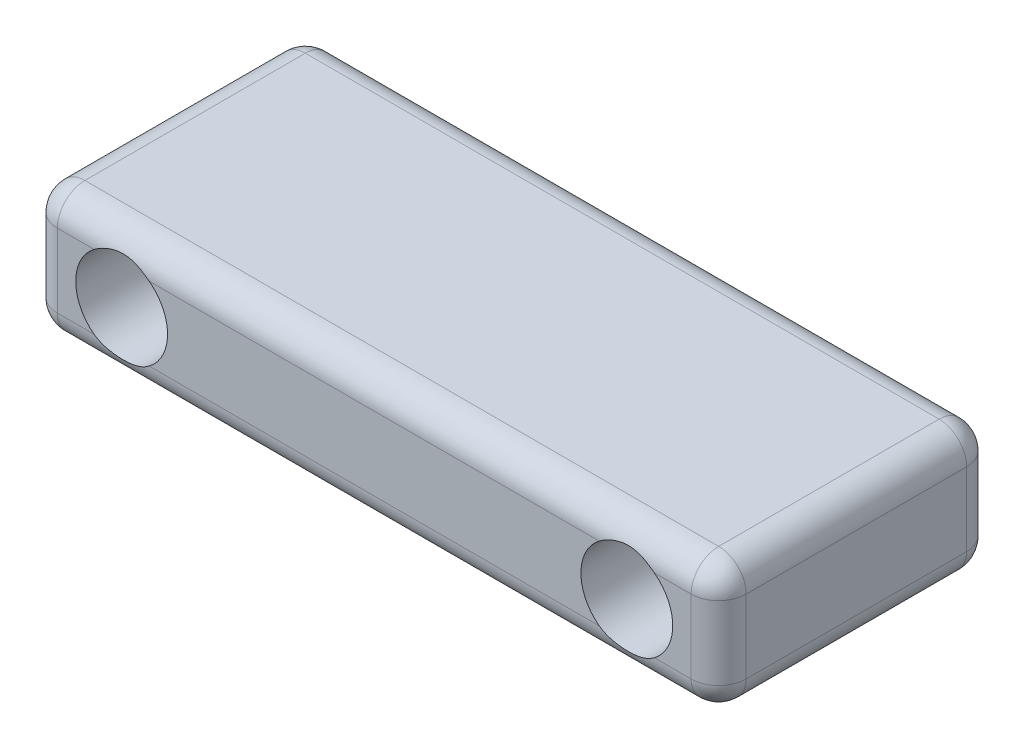
from build123d import *

# Parameters (mm, degrees)
SKETCH1_W           = 75
SKETCH1_H           = 14
SKETCH1_R           = 5
BOSS_EXTRUDE1_DEPTH = 30
FILLET1_R           = 3


with BuildPart() as part:
    # Sketch1 → Boss-Extrude1 (new body)
    with BuildSketch(Plane.XY):
        Rectangle(SKETCH1_W, SKETCH1_H)
        with Locations((27.5, 0)):
            Circle(SKETCH1_R, mode=Mode.SUBTRACT)
        with Locations((-27.5, 0)):
            Circle(SKETCH1_R, mode=Mode.SUBTRACT)
    extrude(amount=BOSS_EXTRUDE1_DEPTH)

    # Fillet1
    # the kernel refuses this fillet: 3 mm, written as the material it takes off along each edge
    with BuildSketch(Plane(origin=(-34.5, 4, 27), x_dir=(-1, 0, 0), z_dir=(0, 1, 0))) as fillet1_piece_1_section:
        Polygon((0, 0), (FILLET1_R, 0), (FILLET1_R, FILLET1_R), (0, FILLET1_R), align=None)
    fillet1_piece_1 = extrude(amount=FILLET1_R, mode=Mode.PRIVATE)
    fillet1_piece_1 = fillet1_piece_1 - Plane(origin=(-34.5, 4, 27), x_dir=(0.7071067811865475, 0, -0.7071067811865475), z_dir=(0, 1, 0)) * Sphere(FILLET1_R, mode=Mode.PRIVATE)
    add(fillet1_piece_1, mode=Mode.SUBTRACT)
    with BuildSketch(Plane(origin=(-34.5, -4, 27), x_dir=(-1, 0, 0), z_dir=(0, -1, 0))) as fillet1_piece_2_section:
        Polygon((0, 0), (FILLET1_R, 0), (FILLET1_R, -FILLET1_R), (0, -FILLET1_R), align=None)
    fillet1_piece_2 = extrude(amount=FILLET1_R, mode=Mode.PRIVATE)
    fillet1_piece_2 = fillet1_piece_2 - Plane(origin=(-34.5, -4, 27), x_dir=(0.7071067811865475, 0, -0.7071067811865475), z_dir=(0, -1, 0)) * Sphere(FILLET1_R, mode=Mode.PRIVATE)
    add(fillet1_piece_2, mode=Mode.SUBTRACT)
    with BuildSketch(Plane(origin=(34.5, -4, 27), x_dir=(1, 0, 0), z_dir=(0, -1, 0))) as fillet1_piece_3_section:
        Polygon((0, 0), (FILLET1_R, 0), (FILLET1_R, FILLET1_R), (0, FILLET1_R), align=None)
    fillet1_piece_3 = extrude(amount=FILLET1_R, mode=Mode.PRIVATE)
    fillet1_piece_3 = fillet1_piece_3 - Plane(origin=(34.5, -4, 27), x_dir=(-0.7071067811865475, 0, -0.7071067811865475), z_dir=(0, -1, 0)) * Sphere(FILLET1_R, mode=Mode.PRIVATE)
    add(fillet1_piece_3, mode=Mode.SUBTRACT)
    with BuildSketch(Plane(origin=(34.5, 4, 27), x_dir=(0, 1, 0), z_dir=(1, 0, 0))) as fillet1_piece_4_section:
        Polygon((0, 0), (FILLET1_R, 0), (FILLET1_R, FILLET1_R), (0, FILLET1_R), align=None)
    fillet1_piece_4 = extrude(amount=FILLET1_R, mode=Mode.PRIVATE)
    fillet1_piece_4 = fillet1_piece_4 - Plane(origin=(34.5, 4, 27), x_dir=(0, -0.7071067811865475, -0.7071067811865475), z_dir=(1, 0, 0)) * Sphere(FILLET1_R, mode=Mode.PRIVATE)
    add(fillet1_piece_4, mode=Mode.SUBTRACT)
    with BuildSketch(Plane(origin=(-34.5, -4, 3), x_dir=(-1, 0, 0), z_dir=(0, -1, 0))) as fillet1_piece_5_section:
        Polygon((0, 0), (FILLET1_R, 0), (FILLET1_R, FILLET1_R), (0, FILLET1_R), align=None)
    fillet1_piece_5 = extrude(amount=FILLET1_R, mode=Mode.PRIVATE)
    fillet1_piece_5 = fillet1_piece_5 - Plane(origin=(-34.5, -4, 3), x_dir=(0.7071067811865475, 0, 0.7071067811865475), z_dir=(0, -1, 0)) * Sphere(FILLET1_R, mode=Mode.PRIVATE)
    add(fillet1_piece_5, mode=Mode.SUBTRACT)
    with BuildSketch(Plane(origin=(34.5, -4, 3), x_dir=(1, 0, 0), z_dir=(0, -1, 0))) as fillet1_piece_6_section:
        Polygon((0, 0), (FILLET1_R, 0), (FILLET1_R, -FILLET1_R), (0, -FILLET1_R), align=None)
    fillet1_piece_6 = extrude(amount=FILLET1_R, mode=Mode.PRIVATE)
    fillet1_piece_6 = fillet1_piece_6 - Plane(origin=(34.5, -4, 3), x_dir=(-0.7071067811865475, 0, 0.7071067811865475), z_dir=(0, -1, 0)) * Sphere(FILLET1_R, mode=Mode.PRIVATE)
    add(fillet1_piece_6, mode=Mode.SUBTRACT)
    with BuildSketch(Plane(origin=(-34.5, 4, 3), x_dir=(-1, 0, 0), z_dir=(0, 1, 0))) as fillet1_piece_7_section:
        Polygon((0, 0), (FILLET1_R, 0), (FILLET1_R, -FILLET1_R), (0, -FILLET1_R), align=None)
    fillet1_piece_7 = extrude(amount=FILLET1_R, mode=Mode.PRIVATE)
    fillet1_piece_7 = fillet1_piece_7 - Plane(origin=(-34.5, 4, 3), x_dir=(0.7071067811865475, 0, 0.7071067811865475), z_dir=(0, 1, 0)) * Sphere(FILLET1_R, mode=Mode.PRIVATE)
    add(fillet1_piece_7, mode=Mode.SUBTRACT)
    with BuildSketch(Plane(origin=(34.5, 4, 3), x_dir=(0, 1, 0), z_dir=(1, 0, 0))) as fillet1_piece_8_section:
        Polygon((0, 0), (FILLET1_R, 0), (FILLET1_R, -FILLET1_R), (0, -FILLET1_R), align=None)
    fillet1_piece_8 = extrude(amount=FILLET1_R, mode=Mode.PRIVATE)
    fillet1_piece_8 = fillet1_piece_8 - Plane(origin=(34.5, 4, 3), x_dir=(0, -0.7071067811865475, 0.7071067811865475), z_dir=(1, 0, 0)) * Sphere(FILLET1_R, mode=Mode.PRIVATE)
    add(fillet1_piece_8, mode=Mode.SUBTRACT)
    with BuildSketch(Plane(origin=(-37.5, 4, 30), x_dir=(0, 0, -1), z_dir=(0, -1, 0)), Plane(origin=(37.5, -4, 30), x_dir=(0, 0, -1), z_dir=(0, 1, 0))) as fillet1_piece_9:
        with BuildLine():
            CenterArc((FILLET1_R, FILLET1_R), FILLET1_R, 180, 90)
            Line((0, FILLET1_R), (0, 0))
            Line((0, 0), (FILLET1_R, 0))
        make_face()
    extrude(amount=8, mode=Mode.SUBTRACT)
    with BuildSketch(Plane(origin=(-34.5, -7, 30), x_dir=(0, 0, -1), z_dir=(1, 0, 0)), Plane(origin=(34.5, 7, 30), x_dir=(0, 0, -1), z_dir=(-1, 0, 0))) as fillet1_piece_10:
        with BuildLine():
            CenterArc((FILLET1_R, FILLET1_R), FILLET1_R, 180, 90)
            Line((0, FILLET1_R), (0, 0))
            Line((0, 0), (FILLET1_R, 0))
        make_face()
    extrude(amount=69, mode=Mode.SUBTRACT)
    with BuildSketch(Plane(origin=(-34.5, -7, 0), x_dir=(0, 0, 1), z_dir=(1, 0, 0)), Plane(origin=(34.5, 7, 0), x_dir=(0, 0, 1), z_dir=(-1, 0, 0))) as fillet1_piece_11:
        with BuildLine():
            CenterArc((FILLET1_R, -FILLET1_R), FILLET1_R, 90, 90)
            Line((0, -FILLET1_R), (0, 0))
            Line((0, 0), (FILLET1_R, 0))
        make_face()
    extrude(amount=69, mode=Mode.SUBTRACT)
    with BuildSketch(Plane(origin=(-37.5, 4, 0), x_dir=(0, 0, 1), z_dir=(0, -1, 0)), Plane(origin=(37.5, -4, 0), x_dir=(0, 0, 1), z_dir=(0, 1, 0))) as fillet1_piece_12:
        with BuildLine():
            CenterArc((FILLET1_R, -FILLET1_R), FILLET1_R, 90, 90)
            Line((0, -FILLET1_R), (0, 0))
            Line((0, 0), (FILLET1_R, 0))
        make_face()
    extrude(amount=8, mode=Mode.SUBTRACT)
    with BuildSketch(Plane(origin=(37.5, -7, 3), x_dir=(-1, 0, 0), z_dir=(0, 0, 1)), Plane(origin=(-37.5, 7, 3), x_dir=(1, 0, 0), z_dir=(0, 0, 1)), Plane(origin=(37.5, 7, 3), x_dir=(0, -1, 0), z_dir=(0, 0, 1))) as fillet1_piece_13:
        with BuildLine():
            CenterArc((FILLET1_R, -FILLET1_R), FILLET1_R, 90, 90)
            Line((0, -FILLET1_R), (0, 0))
            Line((0, 0), (FILLET1_R, 0))
        make_face()
    extrude(amount=24, mode=Mode.SUBTRACT)
    with BuildSketch(Plane(origin=(-37.5, -7, 3), x_dir=(1, 0, 0), z_dir=(0, 0, 1))) as fillet1_piece_14:
        with BuildLine():
            CenterArc((FILLET1_R, FILLET1_R), FILLET1_R, 180, 90)
            Line((0, FILLET1_R), (0, 0))
            Line((0, 0), (FILLET1_R, 0))
        make_face()
    extrude(amount=24, mode=Mode.SUBTRACT)


solid = part.part
